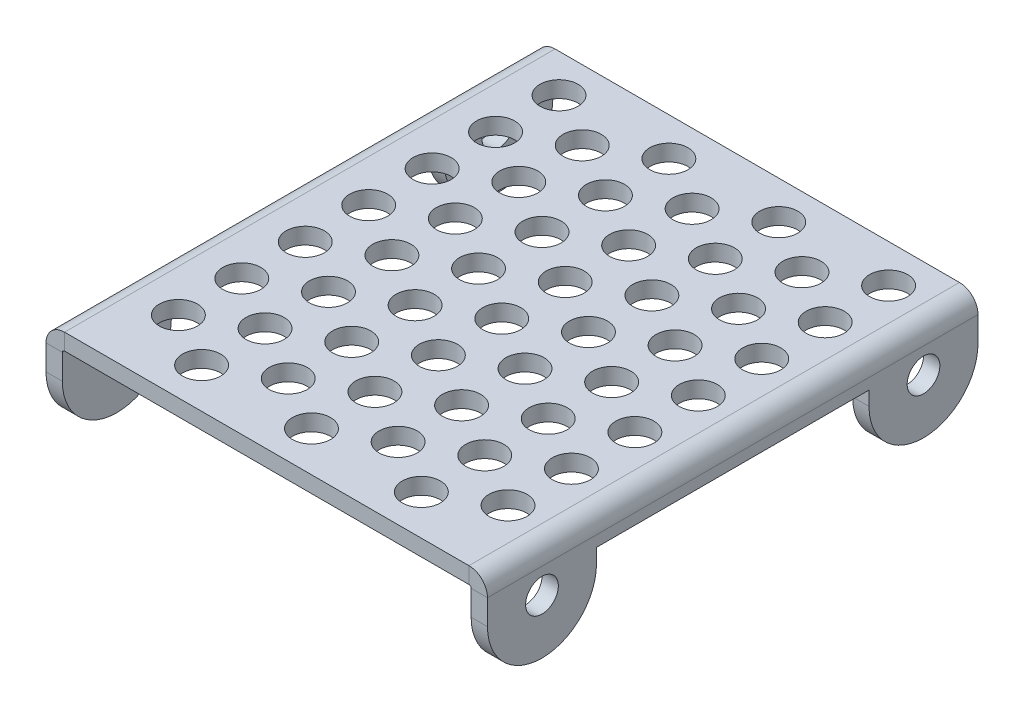
from build123d import *

# Parameters (mm, degrees)
BASE_FLANGE1_DEPTH      = 11.25
SKETCH7_R               = 0.75
CUT_EXTRUDE1_DEPTH      = 24.598199084
SKETCH9_R               = 0.875
CUT_EXTRUDE2_DEPTH      = 16.790127454
FILL_START              = -0.75
FILL_PATTERN1_OUTLINE_R = 0.875
FILL_PATTERN1_DEPTH     = 0.75


# Read off the part's stored shape, not the designer's step: Fill Pattern1
# Sheet-metal steps are written as plain solids
with BuildPart() as part:
    # Sketch1 → Base-Flange1 (new, symmetric)
    with BuildSketch(Plane.XY):
        with BuildLine():
            Line((-10.125, -4.5), (-10.125, -0.85))
            ThreePointArc((-10.125, -0.85), (-9.876040764, -0.248959236), (-9.275, 0))
            Line((-9.275, 0), (9.275, 0))
            ThreePointArc((9.275, 0), (9.876040764, -0.248959236), (10.125, -0.85))
            Line((10.125, -0.85), (10.125, -4.5))
            Line((10.125, -4.5), (9.375, -4.5))
            Line((9.375, -4.5), (9.375, -0.85))
            ThreePointArc((9.375, -0.85), (9.345710678, -0.779289322), (9.275, -0.75))
            Line((9.275, -0.75), (-9.275, -0.75))
            ThreePointArc((-9.275, -0.75), (-9.345710678, -0.779289322), (-9.375, -0.85))
            Line((-9.375, -0.85), (-9.375, -4.5))
            Line((-9.375, -4.5), (-10.125, -4.5))
        make_face()
    extrude(amount=BASE_FLANGE1_DEPTH, both=True)

    # Sketch7 → Cut-Extrude1 (cut, through all)
    with BuildSketch(Plane(origin=(10.125, 0, 0), x_dir=(0, 0, -1), z_dir=(1, 0, 0))):
        with BuildLine():
            Line((-6.25, -1.35), (-6.25, -2))
            ThreePointArc((-6.25, -2), (-6.982233047, -3.767766953), (-8.75, -4.5))
            Line((-8.75, -4.5), (8.749999987, -4.5))
            ThreePointArc((8.749999987, -4.5), (6.982233042, -3.767766948), (6.25, -2))
            Line((6.25, -2), (6.25, -1.35))
            Line((6.25, -1.35), (-6.25, -1.35))
        make_face()
        with BuildLine():
            Line((-11.25, -4.5), (-8.75, -4.5))
            ThreePointArc((-8.75, -4.5), (-10.517766953, -3.767766953), (-11.25, -2))
            Line((-11.25, -2), (-11.25, -4.5))
        make_face()
        with BuildLine():
            ThreePointArc((11.25, -2), (10.517766948, -3.767766958), (8.749999987, -4.5))
            Line((8.749999987, -4.5), (11.25, -4.5))
            Line((11.25, -4.5), (11.25, -2))
        make_face()
        with Locations((8.75, -2)):
            Circle(SKETCH7_R)
        with Locations(Location((-8.75, -2, 0), (0, 0, 180))):
            Circle(SKETCH7_R)
    extrude(amount=-CUT_EXTRUDE1_DEPTH, mode=Mode.SUBTRACT)

    # Sketch9 → Cut-Extrude2 (cut, through all)
    with BuildSketch(Plane(origin=(0, 0, 0), x_dir=(1, 0, 0), z_dir=(0, 1, 0))):
        with Locations(Location((7.775, 9.5, 0), (0, 0, 180))):
            Circle(SKETCH9_R)
    extrude(amount=-CUT_EXTRUDE2_DEPTH, mode=Mode.SUBTRACT)

    # Fill Pattern1 outline → Fill Pattern1 (cut)
    with BuildSketch(Plane(origin=(0, 0, 0), x_dir=(1, 0, 0), z_dir=(0, 1, 0)).offset(FILL_START)):
        with Locations((-4.824497758, -9.413240898)):
            Circle(FILL_PATTERN1_OUTLINE_R)
        with Locations((-2.304598206, 6.590270631)):
            Circle(FILL_PATTERN1_OUTLINE_R)
        with Locations((-4.824497758, 8.045135316)):
            Circle(FILL_PATTERN1_OUTLINE_R)
        with Locations((-7.344397309, 9.5)):
            Circle(FILL_PATTERN1_OUTLINE_R)
        with Locations((7.775, 3.680541262)):
            Circle(FILL_PATTERN1_OUTLINE_R)
        with Locations((0.215301345, 5.135405947)):
            Circle(FILL_PATTERN1_OUTLINE_R)
        with Locations((2.735200897, 3.680541262)):
            Circle(FILL_PATTERN1_OUTLINE_R)
        with Locations((5.255100448, 2.225676578)):
            Circle(FILL_PATTERN1_OUTLINE_R)
        with Locations((7.775, 0.770811893)):
            Circle(FILL_PATTERN1_OUTLINE_R)
        with Locations((2.735200897, 9.5)):
            Circle(FILL_PATTERN1_OUTLINE_R)
        with Locations((5.255100448, 8.045135316)):
            Circle(FILL_PATTERN1_OUTLINE_R)
        with Locations((7.775, 6.590270631)):
            Circle(FILL_PATTERN1_OUTLINE_R)
        with Locations((-2.304598206, 9.5)):
            Circle(FILL_PATTERN1_OUTLINE_R)
        with Locations((0.215301345, 8.045135316)):
            Circle(FILL_PATTERN1_OUTLINE_R)
        with Locations((2.735200897, 6.590270631)):
            Circle(FILL_PATTERN1_OUTLINE_R)
        with Locations((5.255100448, 5.135405947)):
            Circle(FILL_PATTERN1_OUTLINE_R)
        with Locations((7.775, -7.958376213)):
            Circle(FILL_PATTERN1_OUTLINE_R)
        with Locations((-7.344397309, -2.138917475)):
            Circle(FILL_PATTERN1_OUTLINE_R)
        with Locations((-4.824497758, -3.59378216)):
            Circle(FILL_PATTERN1_OUTLINE_R)
        with Locations((-2.304598206, -5.048646844)):
            Circle(FILL_PATTERN1_OUTLINE_R)
        with Locations((5.255100448, -6.503511529)):
            Circle(FILL_PATTERN1_OUTLINE_R)
        with Locations((2.735200897, -5.048646844)):
            Circle(FILL_PATTERN1_OUTLINE_R)
        with Locations((0.215301345, -3.59378216)):
            Circle(FILL_PATTERN1_OUTLINE_R)
        with Locations((-2.304598206, -2.138917475)):
            Circle(FILL_PATTERN1_OUTLINE_R)
        with Locations((-4.824497758, -6.503511529)):
            Circle(FILL_PATTERN1_OUTLINE_R)
        with Locations((-2.304598206, -7.958376213)):
            Circle(FILL_PATTERN1_OUTLINE_R)
        with Locations((0.215301345, -9.413240898)):
            Circle(FILL_PATTERN1_OUTLINE_R)
        with Locations((-7.344397309, -7.958376213)):
            Circle(FILL_PATTERN1_OUTLINE_R)
        with Locations((0.215301345, -6.503511529)):
            Circle(FILL_PATTERN1_OUTLINE_R)
        with Locations((2.735200897, -7.958376213)):
            Circle(FILL_PATTERN1_OUTLINE_R)
        with Locations((5.255100448, -9.413240898)):
            Circle(FILL_PATTERN1_OUTLINE_R)
        with Locations((-7.344397309, -5.048646844)):
            Circle(FILL_PATTERN1_OUTLINE_R)
        with Locations((2.735200897, 0.770811893)):
            Circle(FILL_PATTERN1_OUTLINE_R)
        with Locations((5.255100448, -0.684052791)):
            Circle(FILL_PATTERN1_OUTLINE_R)
        with Locations((7.775, -2.138917475)):
            Circle(FILL_PATTERN1_OUTLINE_R)
        with Locations((-7.344397309, 3.680541262)):
            Circle(FILL_PATTERN1_OUTLINE_R)
        with Locations((0.215301345, 2.225676578)):
            Circle(FILL_PATTERN1_OUTLINE_R)
        with Locations((-2.304598206, 3.680541262)):
            Circle(FILL_PATTERN1_OUTLINE_R)
        with Locations((-4.824497758, 5.135405947)):
            Circle(FILL_PATTERN1_OUTLINE_R)
        with Locations((-7.344397309, 6.590270631)):
            Circle(FILL_PATTERN1_OUTLINE_R)
        with Locations((-4.824497758, -0.684052791)):
            Circle(FILL_PATTERN1_OUTLINE_R)
        with Locations((-7.344397309, 0.770811893)):
            Circle(FILL_PATTERN1_OUTLINE_R)
        with Locations((7.775, -5.048646844)):
            Circle(FILL_PATTERN1_OUTLINE_R)
        with Locations((5.255100448, -3.59378216)):
            Circle(FILL_PATTERN1_OUTLINE_R)
        with Locations((2.735200897, -2.138917475)):
            Circle(FILL_PATTERN1_OUTLINE_R)
        with Locations((0.215301345, -0.684052791)):
            Circle(FILL_PATTERN1_OUTLINE_R)
        with Locations((-2.304598206, 0.770811893)):
            Circle(FILL_PATTERN1_OUTLINE_R)
        with Locations((-4.824497758, 2.225676578)):
            Circle(FILL_PATTERN1_OUTLINE_R)
    extrude(amount=FILL_PATTERN1_DEPTH, mode=Mode.SUBTRACT)


solid = part.part
